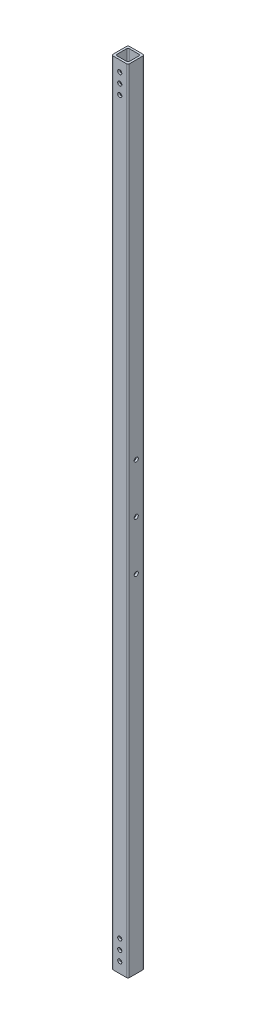
from build123d import *

# Parameters (mm, degrees)
SKETCH1_W           = 25.4
SKETCH1_H           = 25.4
SKETCH1_W_2         = 19.05
SKETCH1_H_2         = 19.05
BOSS_EXTRUDE1_DEPTH = 609.6
FILLET1_R           = 2.1082
SKETCH6_R           = 3.175
CUT_EXTRUDE5_DEPTH  = 611.261099858
SKETCH7_R           = 3.175
CUT_EXTRUDE6_DEPTH  = 611.261099858
SKETCH8_R           = 3.175
CUT_EXTRUDE7_DEPTH  = 611.261099858


with BuildPart() as part:
    # Sketch1 → Boss-Extrude1 (new, symmetric)
    with BuildSketch(Plane(origin=(0, 0, 0), x_dir=(1, 0, 0), z_dir=(0, 1, 0))):
        Rectangle(SKETCH1_W, SKETCH1_H)
        Rectangle(SKETCH1_W_2, SKETCH1_H_2, mode=Mode.SUBTRACT)
    extrude(amount=BOSS_EXTRUDE1_DEPTH, both=True)

    # Fillet1
    fillet1_edges = [part.edges().sort_by_distance(p)[0] for p in [
        (9.525, 0, -9.525),
        (-9.525, 0, -9.525),
        (-9.525, 0, 9.525),
        (9.525, 0, 9.525),
        (12.7, 0, -12.7),
        (-12.7, 0, -12.7),
        (-12.7, 0, 12.7),
        (12.7, 0, 12.7),
    ]]
    fillet(fillet1_edges, radius=FILLET1_R)

    # Sketch6 → Cut-Extrude5 (cut, through all)
    with BuildSketch(Plane(origin=(0, 0, -12.7), x_dir=(-1, 0, 0), z_dir=(0, 0, -1))):
        with Locations((0, 562.61)):
            Circle(SKETCH6_R)
        with Locations((0, 577.85)):
            Circle(SKETCH6_R)
        with Locations((0, 593.09)):
            Circle(SKETCH6_R)
    cut_extrude5 = extrude(amount=-CUT_EXTRUDE5_DEPTH, mode=Mode.SUBTRACT)

    # Sketch7 → Cut-Extrude6 (cut, through all)
    with BuildSketch(Plane.ZY.offset(12.7)):
        Circle(SKETCH7_R)
    extrude(amount=-CUT_EXTRUDE6_DEPTH, mode=Mode.SUBTRACT)

    # Sketch8 → Cut-Extrude7 (cut, through all)
    with BuildSketch(Plane.ZY.offset(12.7)):
        with Locations((0, -76.2)):
            Circle(SKETCH8_R)
    cut_extrude7 = extrude(amount=-CUT_EXTRUDE7_DEPTH, mode=Mode.SUBTRACT)

    # Mirror1: Cut-Extrude7 across plane
    add(cut_extrude7.mirror(Plane.ZX), mode=Mode.SUBTRACT)

    # Mirror2: Cut-Extrude5 across plane
    add(cut_extrude5.mirror(Plane.ZX), mode=Mode.SUBTRACT)


solid = part.part
